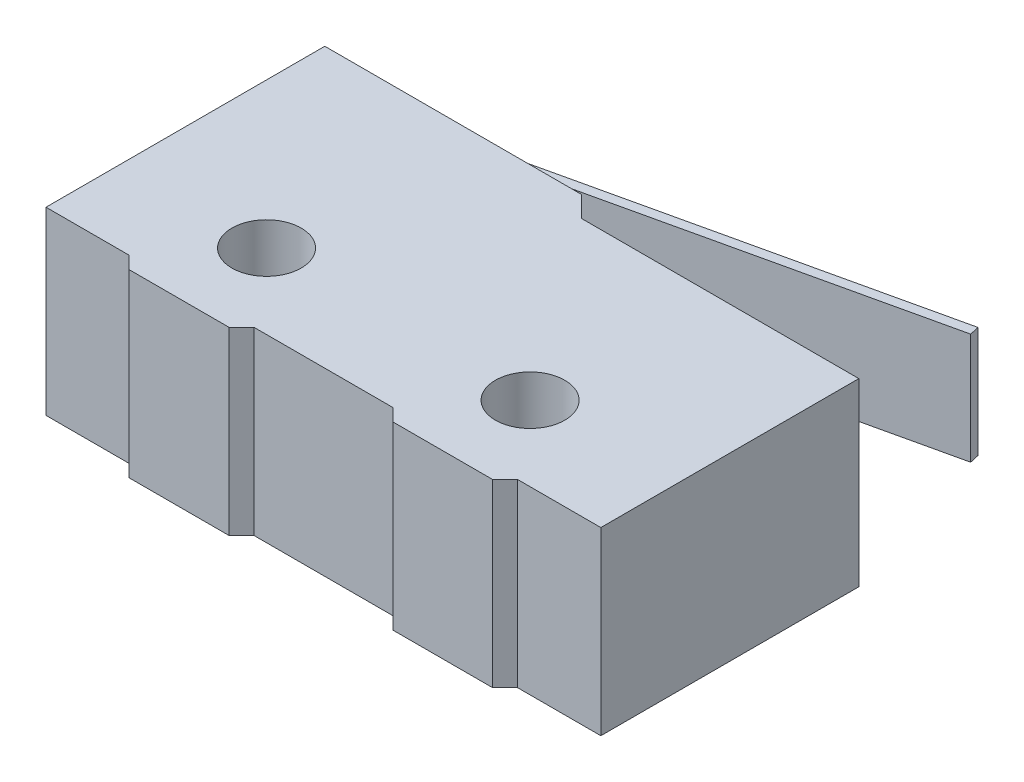
from build123d import *

# Parameters (mm, degrees)
SKETCH_1_W          = 20
SKETCH_1_H          = 10.5
EXTRUDE_1_DEPTH     = 6.5
SKETCH_2_R          = 1.25
CUT_EXTRUDE_1_DEPTH = 6.5
SKETCH_3_W          = 4.44626532
SKETCH_3_H          = 1.008872475
SKETCH_3_W_2        = 5
SKETCH_3_W_3        = 3.65317203
CUT_EXTRUDE_2_DEPTH = 6.5
CHAMFER_1_SIZE      = 0.45
SKETCH_4_W          = 10.31021277
SKETCH_4_H          = 1.008783122
CUT_EXTRUDE_3_DEPTH = 6.5
CHAMFER_2_SIZE      = 0.75
EXTRUDE_2_DEPTH     = 4


with BuildPart() as part:
    # 스케치1 → 보스-돌출1 (new body)
    with BuildSketch(Plane(origin=(0, 0, 0), x_dir=(1, 0, 0), z_dir=(0, 1, 0))):
        Rectangle(SKETCH_1_W, SKETCH_1_H)
    extrude(amount=EXTRUDE_1_DEPTH)

    # 스케치2 → 컷-돌출1 (cut)
    with BuildSketch(Plane(origin=(0, 6.5, 0), x_dir=(1, 0, 0), z_dir=(0, 1, 0))):
        with Locations(Location((-4.75, -2.1, 0), (0, 0, 270))):
            Circle(SKETCH_2_R)
        with Locations(Location((4.75, -2.1, 0), (0, 0, 270))):
            Circle(SKETCH_2_R)
    extrude(amount=-CUT_EXTRUDE_1_DEPTH, mode=Mode.SUBTRACT)

    # 스케치3 → 컷-돌출2 (cut)
    with BuildSketch(Plane(origin=(0, 6.5, 0), x_dir=(1, 0, 0), z_dir=(0, 1, 0))):
        with Locations((-9.22313266, -5.304436238)):
            Rectangle(SKETCH_3_W, SKETCH_3_H)
        with Locations((0, -5.304436238)):
            Rectangle(SKETCH_3_W_2, SKETCH_3_H)
        with Locations((8.826586015, -5.304436238)):
            Rectangle(SKETCH_3_W_3, SKETCH_3_H)
    extrude(amount=-CUT_EXTRUDE_2_DEPTH, mode=Mode.SUBTRACT)

    # 모따기1
    chamfer_1_edges = [part.edges().sort_by_distance(p)[0] for p in [
        (7, 3.25, 5.25),
        (2.5, 3.25, 5.25),
        (-2.5, 3.25, 5.25),
        (-7, 3.25, 5.25),
    ]]
    chamfer(chamfer_1_edges, length=CHAMFER_1_SIZE - 0.0001)  # a hair under: the kernel refuses the full size

    # 스케치4 → 컷-돌출3 (cut)
    with BuildSketch(Plane(origin=(0, 6.5, 0), x_dir=(1, 0, 0), z_dir=(0, 1, 0))):
        with Locations((5.155106385, 5.004391561)):
            Rectangle(SKETCH_4_W, SKETCH_4_H)
    extrude(amount=-CUT_EXTRUDE_3_DEPTH, mode=Mode.SUBTRACT)

    # 모따기2
    chamfer_2_edges = [part.edges().sort_by_distance(p)[0] for p in [
        (0, 3.25, -5.25),
    ]]
    chamfer(chamfer_2_edges, length=CHAMFER_2_SIZE - 0.0001)  # a hair under: the kernel refuses the full size

    # 스케치5 → 보스-돌출2 (add)
    with BuildSketch(Plane(origin=(0, 5.25, 0), x_dir=(1, 0, 0), z_dir=(0, 1, 0))):
        Polygon((-6.65, 5.25), (-7, 5.25), (-7, 5.807319656), (9.3, 9.495633097), (9.377244102, 9.154263285), (-6.65, 5.527668202), align=None)
    extrude(amount=-EXTRUDE_2_DEPTH)


solid = part.part
